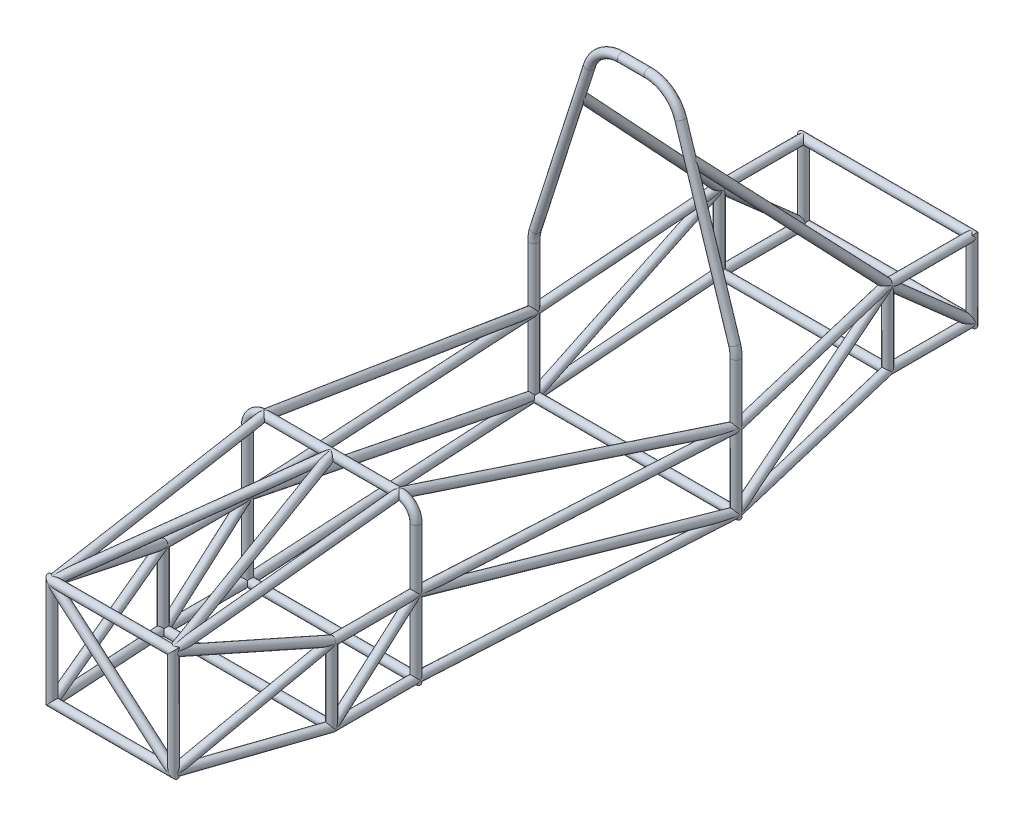
from build123d import *

# Parameters (mm, degrees)
SKETCH11_R                             = 12.7
SKETCH11_R_2                           = 10.3
PIPE_MAIN_HOOP_1_DEPTH                 = 418.960512242
SKETCH11_ON_SEGMENT_2_R                = 12.7
SKETCH11_ON_SEGMENT_2_R_2              = 10.3
PIPE_MAIN_HOOP_1_2_DEPTH               = 637.921024484
SKETCH11_ON_SEGMENT_3_R                = 12.7
SKETCH11_ON_SEGMENT_3_R_2              = 10.3
PIPE_MAIN_HOOP_1_3_DEPTH               = 418.960512242
SKETCH11_ON_SEGMENT_4_R                = 12.7
SKETCH11_ON_SEGMENT_4_R_2              = 10.3
PIPE_MAIN_HOOP_1_4_ANGLE               = 17.744671625
SKETCH11_ON_SEGMENT_5_R                = 12.7
SKETCH11_ON_SEGMENT_5_R_2              = 10.3
PIPE_MAIN_HOOP_1_5_DEPTH               = 524.976189936
SKETCH11_ON_SEGMENT_6_R                = 12.7
SKETCH11_ON_SEGMENT_6_R_2              = 10.3
PIPE_MAIN_HOOP_1_6_ANGLE               = 72.255328375
SKETCH11_ON_SEGMENT_7_R                = 12.7
SKETCH11_ON_SEGMENT_7_R_2              = 10.3
PIPE_MAIN_HOOP_1_7_DEPTH               = 80
SKETCH11_ON_SEGMENT_8_R                = 12.7
SKETCH11_ON_SEGMENT_8_R_2              = 10.3
PIPE_MAIN_HOOP_1_8_ANGLE               = 72.255328375
SKETCH11_ON_SEGMENT_9_R                = 12.7
SKETCH11_ON_SEGMENT_9_R_2              = 10.3
PIPE_MAIN_HOOP_1_9_DEPTH               = 524.976189936
SKETCH11_ON_SEGMENT_10_R               = 12.7
SKETCH11_ON_SEGMENT_10_R_2             = 10.3
PIPE_MAIN_HOOP_1_10_ANGLE              = 17.744671625
PIPE_MAIN_HOOP_2_DEPTH                 = 400
PIPE_MAIN_HOOP_2_DEPTH_BACK            = 18.960512242
SKETCH12_R                             = 12.7
SKETCH12_R_2                           = 10.3
SKETCH12_ON_SEGMENT_2_R                = 12.7
SKETCH12_ON_SEGMENT_2_R_2              = 10.3
PIPE_MAIN_HOOP_2_2_ANGLE               = 90
SKETCH12_ON_SEGMENT_3_R                = 12.7
SKETCH12_ON_SEGMENT_3_R_2              = 10.3
PIPE_MAIN_HOOP_2_3_DEPTH               = 400
SKETCH12_ON_SEGMENT_4_R                = 12.7
SKETCH12_ON_SEGMENT_4_R_2              = 10.3
PIPE_MAIN_HOOP_2_4_ANGLE               = 90
SKETCH12_ON_SEGMENT_5_R                = 12.7
SKETCH12_ON_SEGMENT_5_R_2              = 10.3
PIPE_MAIN_HOOP_2_5_DEPTH               = 418.960512242
SKETCH12_ON_SEGMENT_6_R                = 12.7
SKETCH12_ON_SEGMENT_6_R_2              = 10.3
PIPE_MAIN_HOOP_2_6_DEPTH               = 537.921024484
PIPE_SECONDARY_PROFILE_1_DEPTH         = 328.960512242
PIPE_SECONDARY_PROFILE_1_DEPTH_BACK    = 18.960512242
SKETCH13_R                             = 12.7
SKETCH13_R_2                           = 11.05
SKETCH13_ON_SEGMENT_2_R                = 12.7
SKETCH13_ON_SEGMENT_2_R_2              = 11.05
PIPE_SECONDARY_PROFILE_1_2_DEPTH       = 397.921024484
SKETCH13_ON_SEGMENT_3_R                = 12.7
SKETCH13_ON_SEGMENT_3_R_2              = 11.05
PIPE_SECONDARY_PROFILE_1_3_DEPTH       = 347.921024484
SKETCH13_ON_SEGMENT_4_R                = 12.7
SKETCH13_ON_SEGMENT_4_R_2              = 11.05
PIPE_SECONDARY_PROFILE_1_4_DEPTH       = 397.921024484
SKETCH14_R                             = 12.7
SKETCH14_R_2                           = 11.05
PIPE_SECONDARY_PROFILE_2_DEPTH         = 901.387818866
SKETCH14_ON_SEGMENT_2_R                = 12.7
SKETCH14_ON_SEGMENT_2_R_2              = 11.05
PIPE_SECONDARY_PROFILE_2_2_DEPTH       = 901.387818866
SKETCH15_R                             = 12.7
SKETCH15_R_2                           = 11.05
PIPE_SECONDARY_PROFILE_3_DEPTH         = 927.846970141
SKETCH16_R                             = 12.7
SKETCH16_R_2                           = 11.05
PIPE_SECONDARY_PROFILE_4_DEPTH         = 901.387818866
SKETCH16_ON_SEGMENT_2_R                = 12.7
SKETCH16_ON_SEGMENT_2_R_2              = 11.05
PIPE_SECONDARY_PROFILE_4_2_DEPTH       = 901.387818866
SKETCH17_R                             = 12.7
SKETCH17_R_2                           = 11.05
PIPE_SECONDARY_PROFILE_5_DEPTH         = 927.846970141
SKETCH18_R                             = 12.7
SKETCH18_R_2                           = 11.05
PIPE_SECONDARY_PROFILE_6_DEPTH         = 252.896916642
SKETCH18_ON_SEGMENT_2_R                = 12.7
SKETCH18_ON_SEGMENT_2_R_2              = 11.05
PIPE_SECONDARY_PROFILE_6_2_DEPTH       = 411.921365789
SKETCH19_ON_SEGMENT_1_R                = 12.7
SKETCH19_ON_SEGMENT_1_R_2              = 11.05
PIPE_SECONDARY_PROFILE_7_DEPTH         = 411.921365789
PIPE_SECONDARY_PROFILE_7_2_DEPTH       = 250
PIPE_SECONDARY_PROFILE_7_2_DEPTH_BACK  = 2.896916642
SKETCH19_R                             = 12.7
SKETCH19_R_2                           = 11.05
SKETCH110_R                            = 12.7
SKETCH110_R_2                          = 11.05
PIPE_SECONDARY_PROFILE_8_DEPTH         = 500
SKETCH111_R                            = 12.7
SKETCH111_R_2                          = 11.05
PIPE_SECONDARY_PROFILE_9_DEPTH         = 475.078940809
SKETCH112_R                            = 12.7
SKETCH112_R_2                          = 11.05
PIPE_SECONDARY_PROFILE_10_DEPTH        = 661.245109704
SKETCH112_ON_SEGMENT_2_R               = 12.7
SKETCH112_ON_SEGMENT_2_R_2             = 11.05
PIPE_SECONDARY_PROFILE_10_2_DEPTH      = 938.89254585
SKETCH113_R                            = 12.7
SKETCH113_R_2                          = 11.05
PIPE_SECONDARY_PROFILE_11_DEPTH        = 661.245109704
SKETCH113_ON_SEGMENT_2_R               = 12.7
SKETCH113_ON_SEGMENT_2_R_2             = 11.05
PIPE_SECONDARY_PROFILE_11_2_DEPTH      = 938.89254585
SKETCH114_ON_SEGMENT_1_R               = 12.7
SKETCH114_ON_SEGMENT_1_R_2             = 11.05
PIPE_SECONDARY_PROFILE_12_DEPTH        = 680.574022425
SKETCH114_R                            = 12.7
SKETCH114_R_2                          = 11.05
PIPE_SECONDARY_PROFILE_12_2_DEPTH      = 680.574022425
PIPE_SECONDARY_PROFILE_14_DEPTH        = 518.960512242
PIPE_SECONDARY_PROFILE_14_DEPTH_BACK   = 18.960512242
SKETCH118_R                            = 12.7
SKETCH118_R_2                          = 11.05
SKETCH118_ON_SEGMENT_2_R               = 12.7
SKETCH118_ON_SEGMENT_2_R_2             = 11.05
PIPE_SECONDARY_PROFILE_14_2_DEPTH      = 257.921024484
SKETCH118_ON_SEGMENT_3_R               = 12.7
SKETCH118_ON_SEGMENT_3_R_2             = 11.05
PIPE_SECONDARY_PROFILE_14_3_DEPTH      = 537.921024484
SKETCH118_ON_SEGMENT_4_R               = 12.7
SKETCH118_ON_SEGMENT_4_R_2             = 11.05
PIPE_SECONDARY_PROFILE_14_4_DEPTH      = 257.921024484
SKETCH121_ON_SEGMENT_1_R               = 12.7
SKETCH121_ON_SEGMENT_1_R_2             = 11.05
PIPE_SECONDARY_PROFILE_16_DEPTH        = 433.580673792
PIPE_SECONDARY_PROFILE_16_2_DEPTH      = 250
PIPE_SECONDARY_PROFILE_16_2_DEPTH_BACK = 4.370934853
SKETCH121_R                            = 12.7
SKETCH121_R_2                          = 11.05
SKETCH122_ON_SEGMENT_1_R               = 12.7
SKETCH122_ON_SEGMENT_1_R_2             = 11.05
PIPE_SECONDARY_PROFILE_17_DEPTH        = 433.580673792
PIPE_SECONDARY_PROFILE_17_2_DEPTH      = 250
PIPE_SECONDARY_PROFILE_17_2_DEPTH_BACK = 4.370934853
SKETCH122_R                            = 12.7
SKETCH122_R_2                          = 11.05
SKETCH123_R                            = 12.7
SKETCH123_R_2                          = 11.05
PIPE_SECONDARY_PROFILE_18_DEPTH        = 220
SKETCH124_R                            = 12.7
SKETCH124_R_2                          = 11.05
PIPE_SECONDARY_PROFILE_19_DEPTH        = 220
SKETCH125_R                            = 12.7
SKETCH125_R_2                          = 11.05
PIPE_SECONDARY_PROFILE_20_DEPTH        = 333.016516107
SKETCH126_R                            = 12.7
SKETCH126_R_2                          = 11.05
PIPE_SECONDARY_PROFILE_21_DEPTH        = 333.016516107
SKETCH127_R                            = 12.7
SKETCH127_R_2                          = 11.05
PIPE_SECONDARY_PROFILE_22_DEPTH        = 440.614343843
SKETCH128_R                            = 12.7
SKETCH128_R_2                          = 11.05
PIPE_SECONDARY_PROFILE_23_DEPTH        = 440.614343843
SKETCH129_ON_SEGMENT_1_R               = 12.7
SKETCH129_ON_SEGMENT_1_R_2             = 11.05
PIPE_SECONDARY_PROFILE_24_DEPTH        = 252.86045034
PIPE_SECONDARY_PROFILE_24_2_DEPTH      = 510.84635655
PIPE_SECONDARY_PROFILE_24_2_DEPTH_BACK = 2.86045034
SKETCH129_R                            = 12.7
SKETCH129_R_2                          = 11.05
SKETCH130_R                            = 12.7
SKETCH130_R_2                          = 11.05
PIPE_SECONDARY_PROFILE_25_DEPTH        = 513.70680689
SKETCH130_ON_SEGMENT_2_R               = 12.7
SKETCH130_ON_SEGMENT_2_R_2             = 11.05
PIPE_SECONDARY_PROFILE_25_2_DEPTH      = 252.86045034
SKETCH131_ON_SEGMENT_1_R               = 12.7
SKETCH131_ON_SEGMENT_1_R_2             = 11.05
PIPE_SECONDARY_PROFILE_26_DEPTH        = 252.86045034
PIPE_SECONDARY_PROFILE_26_2_DEPTH      = 510.84635655
PIPE_SECONDARY_PROFILE_26_2_DEPTH_BACK = 2.86045034
SKETCH131_R                            = 12.7
SKETCH131_R_2                          = 11.05
SKETCH132_ON_SEGMENT_1_R               = 12.7
SKETCH132_ON_SEGMENT_1_R_2             = 11.05
PIPE_SECONDARY_PROFILE_27_DEPTH        = 252.86045034
PIPE_SECONDARY_PROFILE_27_2_DEPTH      = 510.84635655
PIPE_SECONDARY_PROFILE_27_2_DEPTH_BACK = 2.86045034
SKETCH132_R                            = 12.7
SKETCH132_R_2                          = 11.05
SKETCH133_ON_SEGMENT_1_R               = 12.7
SKETCH133_ON_SEGMENT_1_R_2             = 11.05
PIPE_SECONDARY_PROFILE_28_DEPTH        = 740.450333948
PIPE_SECONDARY_PROFILE_28_2_DEPTH      = 220
PIPE_SECONDARY_PROFILE_28_2_DEPTH_BACK = 8.230109436
SKETCH133_R                            = 12.7
SKETCH133_R_2                          = 11.05
SKETCH134_R                            = 12.7
SKETCH134_R_2                          = 11.05
PIPE_SECONDARY_PROFILE_29_DEPTH        = 228.230109436
SKETCH134_ON_SEGMENT_2_R               = 12.7
SKETCH134_ON_SEGMENT_2_R_2             = 11.05
PIPE_SECONDARY_PROFILE_29_2_DEPTH      = 740.450333948
SKETCH135_R                            = 12.7
SKETCH135_R_2                          = 11.05
PIPE_SECONDARY_PROFILE_30_DEPTH        = 500
SKETCH137_R                            = 12.7
SKETCH137_R_2                          = 11.05
PIPE_SECONDARY_PROFILE_32_DEPTH        = 591.476119552
SKETCH138_R                            = 12.7
SKETCH138_R_2                          = 11.05
PIPE_SECONDARY_PROFILE_33_DEPTH        = 591.476119552
SKETCH139_R                            = 12.7
SKETCH139_R_2                          = 11.05
PIPE_SECONDARY_PROFILE_34_DEPTH        = 333.016516107
SKETCH140_R                            = 12.7
SKETCH140_R_2                          = 11.05
PIPE_SECONDARY_PROFILE_35_DEPTH        = 333.016516107


with BuildPart() as part:
    # Sketch11 → Pipe MAIN HOOP(1) (new body)
    with BuildSketch(Plane(origin=(600, 400, 0), x_dir=(1, 0, 0), z_dir=(0, -1, 0))):
        Circle(SKETCH11_R)
        Circle(SKETCH11_R_2, mode=Mode.SUBTRACT)
    extrude(amount=PIPE_MAIN_HOOP_1_DEPTH)

    # Pipe MAIN HOOP(1) mitre 1
    split(bisect_by=Plane(origin=(600, 0, 0), x_dir=(-0.707106781, 0.707106781, 0), z_dir=(0.707106781, 0.707106781, 0)), keep=Keep.TOP)


with BuildPart() as body_2:
    # Sketch11 on segment 2 (carried to segment 2) → Pipe MAIN HOOP_1 2 (new body)
    with BuildSketch(Plane(origin=(618.960512242, 0, 0), x_dir=(0, -1, 0), z_dir=(-1, 0, 0))):
        Circle(SKETCH11_ON_SEGMENT_2_R)
        Circle(SKETCH11_ON_SEGMENT_2_R_2, mode=Mode.SUBTRACT)
    extrude(amount=PIPE_MAIN_HOOP_1_2_DEPTH)

    # Pipe MAIN HOOP_1 2 mitre 1
    split(bisect_by=Plane(origin=(600, 0, 0), x_dir=(0.707106781, -0.707106781, 0), z_dir=(-0.707106781, -0.707106781, 0)), keep=Keep.TOP)

    # Pipe MAIN HOOP_1 2 mitre 2
    split(bisect_by=Plane(origin=(0, 0, 0), x_dir=(0.707106781, 0.707106781, 0), z_dir=(0.707106781, -0.707106781, 0)), keep=Keep.TOP)


with BuildPart() as body_3:
    # Sketch11 on segment 3 (carried to segment 3) → Pipe MAIN HOOP_1 3 (new body)
    with BuildSketch(Plane(origin=(0, -18.960512242, 0), x_dir=(-1, 0, 0), z_dir=(0, 1, 0))):
        Circle(SKETCH11_ON_SEGMENT_3_R)
        Circle(SKETCH11_ON_SEGMENT_3_R_2, mode=Mode.SUBTRACT)
    extrude(amount=PIPE_MAIN_HOOP_1_3_DEPTH)

    # Pipe MAIN HOOP_1 3 mitre 1
    split(bisect_by=Plane(origin=(0, 0, 0), x_dir=(-0.707106781, -0.707106781, 0), z_dir=(-0.707106781, 0.707106781, 0)), keep=Keep.TOP)


with BuildPart() as body_4:
    # Sketch11 on segment 4 (carried to the start of arc 4) → Pipe MAIN HOOP_1 4 (revolve)
    with BuildSketch(Plane(origin=(0, 400, 0), x_dir=(-1, 0, 0), z_dir=(0, 1, 0))):
        Circle(SKETCH11_ON_SEGMENT_4_R)
        Circle(SKETCH11_ON_SEGMENT_4_R_2, mode=Mode.SUBTRACT)
    revolve(axis=Axis((100, 400, 0), (0, 0, -1)), revolution_arc=PIPE_MAIN_HOOP_1_4_ANGLE)


with BuildPart() as body_5:
    # Sketch11 on segment 5 (carried to segment 5) → Pipe MAIN HOOP_1 5 (new body)
    with BuildSketch(Plane(origin=(4.75758528, 430.47757271, 0), x_dir=(-0.952424147, 0.304775727, 0), z_dir=(0.304775727, 0.952424147, 0))):
        Circle(SKETCH11_ON_SEGMENT_5_R)
        Circle(SKETCH11_ON_SEGMENT_5_R_2, mode=Mode.SUBTRACT)
    extrude(amount=PIPE_MAIN_HOOP_1_5_DEPTH)


with BuildPart() as body_6:
    # Sketch11 on segment 6 (carried to the start of arc 6) → Pipe MAIN HOOP_1 6 (revolve)
    with BuildSketch(Plane(origin=(164.75758528, 930.47757271, 0), x_dir=(-0.952424147, 0.304775727, 0), z_dir=(0.304775727, 0.952424147, 0))):
        Circle(SKETCH11_ON_SEGMENT_6_R)
        Circle(SKETCH11_ON_SEGMENT_6_R_2, mode=Mode.SUBTRACT)
    revolve(axis=Axis((260, 900, 0), (0, 0, -1)), revolution_arc=PIPE_MAIN_HOOP_1_6_ANGLE)


with BuildPart() as body_7:
    # Sketch11 on segment 7 (carried to segment 7) → Pipe MAIN HOOP_1 7 (new body)
    with BuildSketch(Plane(origin=(260, 1000, 0), x_dir=(0, 1, 0), z_dir=(1, 0, 0))):
        Circle(SKETCH11_ON_SEGMENT_7_R)
        Circle(SKETCH11_ON_SEGMENT_7_R_2, mode=Mode.SUBTRACT)
    extrude(amount=PIPE_MAIN_HOOP_1_7_DEPTH)


with BuildPart() as body_8:
    # Sketch11 on segment 8 (carried to the start of arc 8) → Pipe MAIN HOOP_1 8 (revolve)
    with BuildSketch(Plane(origin=(340, 1000, 0), x_dir=(0, 1, 0), z_dir=(1, 0, 0))):
        Circle(SKETCH11_ON_SEGMENT_8_R)
        Circle(SKETCH11_ON_SEGMENT_8_R_2, mode=Mode.SUBTRACT)
    revolve(axis=Axis((340, 900, 0), (0, 0, -1)), revolution_arc=PIPE_MAIN_HOOP_1_8_ANGLE)


with BuildPart() as body_9:
    # Sketch11 on segment 9 (carried to segment 9) → Pipe MAIN HOOP_1 9 (new body)
    with BuildSketch(Plane(origin=(435.24241472, 930.47757271, 0), x_dir=(0.952424147, 0.304775727, 0), z_dir=(0.304775727, -0.952424147, 0))):
        Circle(SKETCH11_ON_SEGMENT_9_R)
        Circle(SKETCH11_ON_SEGMENT_9_R_2, mode=Mode.SUBTRACT)
    extrude(amount=PIPE_MAIN_HOOP_1_9_DEPTH)


with BuildPart() as body_10:
    # Sketch11 on segment 10 (carried to the start of arc 10) → Pipe MAIN HOOP_1 10 (revolve)
    with BuildSketch(Plane(origin=(595.24241472, 430.47757271, 0), x_dir=(0.952424147, 0.304775727, 0), z_dir=(0.304775727, -0.952424147, 0))):
        Circle(SKETCH11_ON_SEGMENT_10_R)
        Circle(SKETCH11_ON_SEGMENT_10_R_2, mode=Mode.SUBTRACT)
    revolve(axis=Axis((500, 400, 0), (0, 0, -1)), revolution_arc=PIPE_MAIN_HOOP_1_10_ANGLE)


with BuildPart() as body_11:
    # Sketch12 → Pipe MAIN HOOP(2) (new, two sides: drawn at the far end of the back side and taken through both)
    with BuildSketch(Plane(origin=(550, 0, 900), x_dir=(-1, 0, 0), z_dir=(0, 1, 0)).offset(-PIPE_MAIN_HOOP_2_DEPTH_BACK)):
        Circle(SKETCH12_R)
        Circle(SKETCH12_R_2, mode=Mode.SUBTRACT)
    extrude(amount=PIPE_MAIN_HOOP_2_DEPTH + PIPE_MAIN_HOOP_2_DEPTH_BACK)

    # Pipe MAIN HOOP(2) mitre 1
    split(bisect_by=Plane(origin=(550, 0, 900), x_dir=(-0.707106781, 0.707106781, 0), z_dir=(0.707106781, 0.707106781, 0)), keep=Keep.TOP)


with BuildPart() as body_12:
    # Sketch12 on segment 2 (carried to the start of arc 2) → Pipe MAIN HOOP_2 2 (revolve)
    with BuildSketch(Plane(origin=(550, 400, 900), x_dir=(-1, 0, 0), z_dir=(0, 1, 0))):
        Circle(SKETCH12_ON_SEGMENT_2_R)
        Circle(SKETCH12_ON_SEGMENT_2_R_2, mode=Mode.SUBTRACT)
    revolve(axis=Axis((500, 400, 900), (0, 0, 1)), revolution_arc=PIPE_MAIN_HOOP_2_2_ANGLE)


with BuildPart() as body_13:
    # Sketch12 on segment 3 (carried to segment 3) → Pipe MAIN HOOP_2 3 (new body)
    with BuildSketch(Plane(origin=(500, 450, 900), x_dir=(0, -1, 0), z_dir=(-1, 0, 0))):
        Circle(SKETCH12_ON_SEGMENT_3_R)
        Circle(SKETCH12_ON_SEGMENT_3_R_2, mode=Mode.SUBTRACT)
    extrude(amount=PIPE_MAIN_HOOP_2_3_DEPTH)


with BuildPart() as body_14:
    # Sketch12 on segment 4 (carried to the start of arc 4) → Pipe MAIN HOOP_2 4 (revolve)
    with BuildSketch(Plane(origin=(100, 450, 900), x_dir=(0, -1, 0), z_dir=(-1, 0, 0))):
        Circle(SKETCH12_ON_SEGMENT_4_R)
        Circle(SKETCH12_ON_SEGMENT_4_R_2, mode=Mode.SUBTRACT)
    revolve(axis=Axis((100, 400, 900), (0, 0, 1)), revolution_arc=PIPE_MAIN_HOOP_2_4_ANGLE)


with BuildPart() as body_15:
    # Sketch12 on segment 5 (carried to segment 5) → Pipe MAIN HOOP_2 5 (new body)
    with BuildSketch(Plane(origin=(50, 400, 900), x_dir=(1, 0, 0), z_dir=(0, -1, 0))):
        Circle(SKETCH12_ON_SEGMENT_5_R)
        Circle(SKETCH12_ON_SEGMENT_5_R_2, mode=Mode.SUBTRACT)
    extrude(amount=PIPE_MAIN_HOOP_2_5_DEPTH)

    # Pipe MAIN HOOP_2 5 mitre 1
    split(bisect_by=Plane(origin=(50, 0, 900), x_dir=(-0.707106781, -0.707106781, 0), z_dir=(-0.707106781, 0.707106781, 0)), keep=Keep.TOP)


with BuildPart() as body_16:
    # Sketch12 on segment 6 (carried to segment 6) → Pipe MAIN HOOP_2 6 (new body)
    with BuildSketch(Plane(origin=(31.039487758, 0, 900), x_dir=(0, 1, 0), z_dir=(1, 0, 0))):
        Circle(SKETCH12_ON_SEGMENT_6_R)
        Circle(SKETCH12_ON_SEGMENT_6_R_2, mode=Mode.SUBTRACT)
    extrude(amount=PIPE_MAIN_HOOP_2_6_DEPTH)

    # Pipe MAIN HOOP_2 6 mitre 1
    split(bisect_by=Plane(origin=(50, 0, 900), x_dir=(0.707106781, 0.707106781, 0), z_dir=(0.707106781, -0.707106781, 0)), keep=Keep.TOP)

    # Pipe MAIN HOOP_2 6 mitre 2
    split(bisect_by=Plane(origin=(550, 0, 900), x_dir=(0.707106781, -0.707106781, 0), z_dir=(-0.707106781, -0.707106781, 0)), keep=Keep.TOP)


with BuildPart() as body_17:
    # Sketch13 → Pipe SECONDARY PROFILE(1) (new, two sides: drawn at the far end of the back side and taken through both)
    with BuildSketch(Plane(origin=(120, 359, 1550), x_dir=(1, 0, 0), z_dir=(0, -1, 0)).offset(-PIPE_SECONDARY_PROFILE_1_DEPTH_BACK)):
        Circle(SKETCH13_R)
        Circle(SKETCH13_R_2, mode=Mode.SUBTRACT)
    extrude(amount=PIPE_SECONDARY_PROFILE_1_DEPTH + PIPE_SECONDARY_PROFILE_1_DEPTH_BACK)

    # Pipe SECONDARY PROFILE(1) mitre 1
    split(bisect_by=Plane(origin=(120, 359, 1550), x_dir=(0.707106781, -0.707106781, 0), z_dir=(-0.707106781, -0.707106781, 0)), keep=Keep.TOP)

    # Pipe SECONDARY PROFILE(1) mitre 2
    split(bisect_by=Plane(origin=(120, 49, 1550), x_dir=(-0.707106781, -0.707106781, 0), z_dir=(-0.707106781, 0.707106781, 0)), keep=Keep.TOP)


with BuildPart() as body_18:
    # Sketch13 on segment 2 (carried to segment 2) → Pipe SECONDARY PROFILE_1 2 (new body)
    with BuildSketch(Plane(origin=(101.039487758, 49, 1550), x_dir=(0, 1, 0), z_dir=(1, 0, 0))):
        Circle(SKETCH13_ON_SEGMENT_2_R)
        Circle(SKETCH13_ON_SEGMENT_2_R_2, mode=Mode.SUBTRACT)
    extrude(amount=PIPE_SECONDARY_PROFILE_1_2_DEPTH)

    # Pipe SECONDARY PROFILE_1 2 mitre 1
    split(bisect_by=Plane(origin=(120, 49, 1550), x_dir=(0.707106781, 0.707106781, 0), z_dir=(0.707106781, -0.707106781, 0)), keep=Keep.TOP)

    # Pipe SECONDARY PROFILE_1 2 mitre 2
    split(bisect_by=Plane(origin=(480, 49, 1550), x_dir=(0.707106781, -0.707106781, 0), z_dir=(-0.707106781, -0.707106781, 0)), keep=Keep.TOP)


with BuildPart() as body_19:
    # Sketch13 on segment 3 (carried to segment 3) → Pipe SECONDARY PROFILE_1 3 (new body)
    with BuildSketch(Plane(origin=(480, 30.039487758, 1550), x_dir=(-1, 0, 0), z_dir=(0, 1, 0))):
        Circle(SKETCH13_ON_SEGMENT_3_R)
        Circle(SKETCH13_ON_SEGMENT_3_R_2, mode=Mode.SUBTRACT)
    extrude(amount=PIPE_SECONDARY_PROFILE_1_3_DEPTH)

    # Pipe SECONDARY PROFILE_1 3 mitre 1
    split(bisect_by=Plane(origin=(480, 49, 1550), x_dir=(-0.707106781, 0.707106781, 0), z_dir=(0.707106781, 0.707106781, 0)), keep=Keep.TOP)

    # Pipe SECONDARY PROFILE_1 3 mitre 2
    split(bisect_by=Plane(origin=(480, 359, 1550), x_dir=(0.707106781, 0.707106781, 0), z_dir=(0.707106781, -0.707106781, 0)), keep=Keep.TOP)


with BuildPart() as body_20:
    # Sketch13 on segment 4 (carried to segment 4) → Pipe SECONDARY PROFILE_1 4 (new body)
    with BuildSketch(Plane(origin=(498.960512242, 359, 1550), x_dir=(0, -1, 0), z_dir=(-1, 0, 0))):
        Circle(SKETCH13_ON_SEGMENT_4_R)
        Circle(SKETCH13_ON_SEGMENT_4_R_2, mode=Mode.SUBTRACT)
    extrude(amount=PIPE_SECONDARY_PROFILE_1_4_DEPTH)

    # Pipe SECONDARY PROFILE_1 4 mitre 1
    split(bisect_by=Plane(origin=(480, 359, 1550), x_dir=(-0.707106781, -0.707106781, 0), z_dir=(-0.707106781, 0.707106781, 0)), keep=Keep.TOP)

    # Pipe SECONDARY PROFILE_1 4 mitre 2
    split(bisect_by=Plane(origin=(120, 359, 1550), x_dir=(-0.707106781, 0.707106781, 0), z_dir=(0.707106781, 0.707106781, 0)), keep=Keep.TOP)


with BuildPart() as body_21:
    # Sketch14 → Pipe SECONDARY PROFILE(2) (new body)
    with BuildSketch(Plane(origin=(600, 0, 0), x_dir=(0.9984603532054125, 0, 0.05547001962252284), z_dir=(-0.05547001962252284, 0, 0.9984603532054125))):
        Circle(SKETCH14_R)
        Circle(SKETCH14_R_2, mode=Mode.SUBTRACT)
    extrude(amount=PIPE_SECONDARY_PROFILE_2_DEPTH)


with BuildPart() as body_22:
    # Sketch14 on segment 2 (carried to segment 2) → Pipe SECONDARY PROFILE_2 2 (new body)
    with BuildSketch(Plane(origin=(600, 220, 0), x_dir=(0.998460353, 0, 0.05547002), z_dir=(-0.05547002, 0, 0.998460353))):
        Circle(SKETCH14_ON_SEGMENT_2_R)
        Circle(SKETCH14_ON_SEGMENT_2_R_2, mode=Mode.SUBTRACT)
    extrude(amount=PIPE_SECONDARY_PROFILE_2_2_DEPTH)


with BuildPart() as body_23:
    # Sketch15 → Pipe SECONDARY PROFILE(3) (new body)
    with BuildSketch(Plane(origin=(550, 220, 900), x_dir=(0.9032422622823458, 0.4257340459576791, -0.05388819666285796), z_dir=(0.05388819666285806, -0.23710806531657555, -0.9699875399314446))):
        Circle(SKETCH15_R)
        Circle(SKETCH15_R_2, mode=Mode.SUBTRACT)
    extrude(amount=PIPE_SECONDARY_PROFILE_3_DEPTH)


with BuildPart() as body_24:
    # Sketch16 → Pipe SECONDARY PROFILE(4) (new body)
    with BuildSketch(Plane(origin=(0, 0, 0), x_dir=(0.9984603532054125, 0, -0.05547001962252292), z_dir=(0.05547001962252292, 0, 0.9984603532054125))):
        Circle(SKETCH16_R)
        Circle(SKETCH16_R_2, mode=Mode.SUBTRACT)
    extrude(amount=PIPE_SECONDARY_PROFILE_4_DEPTH)


with BuildPart() as body_25:
    # Sketch16 on segment 2 (carried to segment 2) → Pipe SECONDARY PROFILE_4 2 (new body)
    with BuildSketch(Plane(origin=(0, 220, 0), x_dir=(0.998460353, 0, -0.05547002), z_dir=(0.05547002, 0, 0.998460353))):
        Circle(SKETCH16_ON_SEGMENT_2_R)
        Circle(SKETCH16_ON_SEGMENT_2_R_2, mode=Mode.SUBTRACT)
    extrude(amount=PIPE_SECONDARY_PROFILE_4_2_DEPTH)


with BuildPart() as body_26:
    # Sketch17 → Pipe SECONDARY PROFILE(5) (new body)
    with BuildSketch(Plane(origin=(50, 220, 900), x_dir=(0.9032422622823457, -0.4257340459576792, 0.053888196662858), z_dir=(-0.053888196662858066, -0.23710806531657555, -0.9699875399314445))):
        Circle(SKETCH17_R)
        Circle(SKETCH17_R_2, mode=Mode.SUBTRACT)
    extrude(amount=PIPE_SECONDARY_PROFILE_5_DEPTH)


with BuildPart() as body_27:
    # Sketch18 → Pipe SECONDARY PROFILE(6) (new body)
    with BuildSketch(Plane(origin=(50, 0, 900), x_dir=(1, 0, 0), z_dir=(0, 0, 1))):
        Circle(SKETCH18_R)
        Circle(SKETCH18_R_2, mode=Mode.SUBTRACT)
    extrude(amount=PIPE_SECONDARY_PROFILE_6_DEPTH)

    # Pipe SECONDARY PROFILE(6) mitre 1
    split(bisect_by=Plane(origin=(50, 0, 1150), x_dir=(0, 0.998170864, -0.060455988), z_dir=(-0.086045386, -0.06023177, -0.994468866)), keep=Keep.TOP)


with BuildPart() as body_28:
    # Sketch18 on segment 2 (carried to segment 2) → Pipe SECONDARY PROFILE_6 2 (new body)
    with BuildSketch(Plane(origin=(49.504224832, -0.347042617, 1147.166999041), x_dir=(0.985192383, -0.010365332, -0.171138914), z_dir=(0.171138914, 0.11979724, 0.977936651))):
        Circle(SKETCH18_ON_SEGMENT_2_R)
        Circle(SKETCH18_ON_SEGMENT_2_R_2, mode=Mode.SUBTRACT)
    extrude(amount=PIPE_SECONDARY_PROFILE_6_2_DEPTH)

    # Pipe SECONDARY PROFILE_6 2 mitre 1
    split(bisect_by=Plane(origin=(50, 0, 1150), x_dir=(0, -0.998170864, 0.060455988), z_dir=(0.086045386, 0.06023177, 0.994468866)), keep=Keep.TOP)


with BuildPart() as body_29:
    # Sketch19 on segment 1 (carried to segment 1) → Pipe SECONDARY PROFILE(7) (new body)
    with BuildSketch(Plane(origin=(480, 49, 1550), x_dir=(0.985192383, 0.010365332, 0.171138914), z_dir=(0.171138914, -0.11979724, -0.977936651))):
        Circle(SKETCH19_ON_SEGMENT_1_R)
        Circle(SKETCH19_ON_SEGMENT_1_R_2, mode=Mode.SUBTRACT)
    extrude(amount=PIPE_SECONDARY_PROFILE_7_DEPTH)

    # Pipe SECONDARY PROFILE(7) mitre 1
    split(bisect_by=Plane(origin=(550, 0, 1150), x_dir=(0, -0.998170864, 0.060455988), z_dir=(-0.086045386, 0.06023177, 0.994468866)), keep=Keep.TOP)


with BuildPart() as body_30:
    # Sketch19 → Pipe SECONDARY PROFILE_7 2 (new, two sides: drawn at the far end of the back side and taken through both)
    with BuildSketch(Plane(origin=(550, 0, 1150), x_dir=(1, 0, 0), z_dir=(0, 0, -1)).offset(-PIPE_SECONDARY_PROFILE_7_2_DEPTH_BACK)):
        Circle(SKETCH19_R)
        Circle(SKETCH19_R_2, mode=Mode.SUBTRACT)
    extrude(amount=PIPE_SECONDARY_PROFILE_7_2_DEPTH + PIPE_SECONDARY_PROFILE_7_2_DEPTH_BACK)

    # Pipe SECONDARY PROFILE_7 2 mitre 1
    split(bisect_by=Plane(origin=(550, 0, 1150), x_dir=(0, 0.998170864, -0.060455988), z_dir=(0.086045386, -0.06023177, -0.994468866)), keep=Keep.TOP)


with BuildPart() as body_31:
    # Sketch110 → Pipe SECONDARY PROFILE(8) (new body)
    with BuildSketch(Plane(origin=(50, 0, 1150), x_dir=(0, 0, -1), z_dir=(1, 0, 0))):
        Circle(SKETCH110_R)
        Circle(SKETCH110_R_2, mode=Mode.SUBTRACT)
    extrude(amount=PIPE_SECONDARY_PROFILE_8_DEPTH)


with BuildPart() as body_32:
    # Sketch111 → Pipe SECONDARY PROFILE(9) (new body)
    with BuildSketch(Plane(origin=(120, 359, 1550), x_dir=(0.42578644217988465, 0.4944616747895436, -0.757768802353406), z_dir=(0.7577688023534062, -0.6525231353598773, 0))):
        Circle(SKETCH111_R)
        Circle(SKETCH111_R_2, mode=Mode.SUBTRACT)
    extrude(amount=PIPE_SECONDARY_PROFILE_9_DEPTH)


with BuildPart() as body_33:
    # Sketch112 → Pipe SECONDARY PROFILE(10) (new body)
    with BuildSketch(Plane(origin=(120, 359, 1550), x_dir=(0.9083109191261359, 0.41718531797608155, 0.030457916235847243), z_dir=(-0.030457916235847222, 0.1385835188731049, -0.9898822776650352))):
        Circle(SKETCH112_R)
        Circle(SKETCH112_R_2, mode=Mode.SUBTRACT)
    extrude(amount=PIPE_SECONDARY_PROFILE_10_DEPTH)

    # Pipe SECONDARY PROFILE(10) mitre 1
    split(bisect_by=Plane(origin=(100, 450, 900), x_dir=(0, -0.998486223, 0.055002393), z_dir=(0.070113859, 0.054867032, 0.996028943)), keep=Keep.TOP)


with BuildPart() as body_34:
    # Sketch112 on segment 2 (carried to segment 2) → Pipe SECONDARY PROFILE_10 2 (new body)
    with BuildSketch(Plane(origin=(100.49249857, 451.132746712, 904.432487133), x_dir=(0.891916634, 0.404356103, -0.202437297), z_dir=(-0.107033014, -0.246175931, -0.963297122))):
        Circle(SKETCH112_ON_SEGMENT_2_R)
        Circle(SKETCH112_ON_SEGMENT_2_R_2, mode=Mode.SUBTRACT)
    extrude(amount=PIPE_SECONDARY_PROFILE_10_2_DEPTH)

    # Pipe SECONDARY PROFILE_10 2 mitre 1
    split(bisect_by=Plane(origin=(100, 450, 900), x_dir=(0, 0.998486223, -0.055002393), z_dir=(-0.070113859, -0.054867032, -0.996028943)), keep=Keep.TOP)


with BuildPart() as body_35:
    # Sketch113 → Pipe SECONDARY PROFILE(11) (new body)
    with BuildSketch(Plane(origin=(480, 359, 1550), x_dir=(0.908310919126136, -0.4171853179760814, -0.030457916235847274), z_dir=(0.03045791623584735, 0.13858351887310533, -0.9898822776650352))):
        Circle(SKETCH113_R)
        Circle(SKETCH113_R_2, mode=Mode.SUBTRACT)
    extrude(amount=PIPE_SECONDARY_PROFILE_11_DEPTH)

    # Pipe SECONDARY PROFILE(11) mitre 1
    split(bisect_by=Plane(origin=(500, 450, 900), x_dir=(0, -0.998486223, 0.055002393), z_dir=(-0.070113859, 0.054867032, 0.996028943)), keep=Keep.TOP)


with BuildPart() as body_36:
    # Sketch113 on segment 2 (carried to segment 2) → Pipe SECONDARY PROFILE_11 2 (new body)
    with BuildSketch(Plane(origin=(499.50750143, 451.132746712, 904.432487133), x_dir=(0.891916634, -0.404356103, 0.202437297), z_dir=(0.107033014, -0.246175931, -0.963297122))):
        Circle(SKETCH113_ON_SEGMENT_2_R)
        Circle(SKETCH113_ON_SEGMENT_2_R_2, mode=Mode.SUBTRACT)
    extrude(amount=PIPE_SECONDARY_PROFILE_11_2_DEPTH)

    # Pipe SECONDARY PROFILE_11 2 mitre 1
    split(bisect_by=Plane(origin=(500, 450, 900), x_dir=(0, 0.998486223, -0.055002393), z_dir=(0.070113859, -0.054867032, -0.996028943)), keep=Keep.TOP)


with BuildPart() as body_37:
    # Sketch114 on segment 1 (carried to segment 1) → Pipe SECONDARY PROFILE(12) (new body)
    with BuildSketch(Plane(origin=(480, 359, 1550), x_dir=(-0.964220802, -0.018088372, 0.264482619), z_dir=(-0.264482619, 0.133710657, -0.955076125))):
        Circle(SKETCH114_ON_SEGMENT_1_R)
        Circle(SKETCH114_ON_SEGMENT_1_R_2, mode=Mode.SUBTRACT)
    extrude(amount=PIPE_SECONDARY_PROFILE_12_DEPTH)


with BuildPart() as body_38:
    # Sketch114 → Pipe SECONDARY PROFILE_12 2 (new body)
    with BuildSketch(Plane(origin=(300, 450, 900), x_dir=(0.9642208019615072, -0.018088372341682465, 0.2644826191845819), z_dir=(-0.2644826191845819, -0.1337106574766498, 0.9550761248332121))):
        Circle(SKETCH114_R)
        Circle(SKETCH114_R_2, mode=Mode.SUBTRACT)
    extrude(amount=PIPE_SECONDARY_PROFILE_12_2_DEPTH)


with BuildPart() as body_39:
    # Sketch118 → Pipe SECONDARY PROFILE(14) (new, two sides: drawn at the far end of the back side and taken through both)
    with BuildSketch(Plane(origin=(550, 92, -750), x_dir=(0, 0, 1), z_dir=(-1, 0, 0)).offset(-PIPE_SECONDARY_PROFILE_14_DEPTH_BACK)):
        Circle(SKETCH118_R)
        Circle(SKETCH118_R_2, mode=Mode.SUBTRACT)
    extrude(amount=PIPE_SECONDARY_PROFILE_14_DEPTH + PIPE_SECONDARY_PROFILE_14_DEPTH_BACK)

    # Pipe SECONDARY PROFILE(14) mitre 1
    split(bisect_by=Plane(origin=(550, 92, -750), x_dir=(0.707106781, -0.707106781, 0), z_dir=(-0.707106781, -0.707106781, 0)), keep=Keep.TOP)

    # Pipe SECONDARY PROFILE(14) mitre 2
    split(bisect_by=Plane(origin=(50, 92, -750), x_dir=(0.707106781, 0.707106781, 0), z_dir=(0.707106781, -0.707106781, 0)), keep=Keep.TOP)


with BuildPart() as body_40:
    # Sketch118 on segment 2 (carried to segment 2) → Pipe SECONDARY PROFILE_14 2 (new body)
    with BuildSketch(Plane(origin=(50, 73.039487758, -750), x_dir=(0, 0, 1), z_dir=(0, 1, 0))):
        Circle(SKETCH118_ON_SEGMENT_2_R)
        Circle(SKETCH118_ON_SEGMENT_2_R_2, mode=Mode.SUBTRACT)
    extrude(amount=PIPE_SECONDARY_PROFILE_14_2_DEPTH)

    # Pipe SECONDARY PROFILE_14 2 mitre 1
    split(bisect_by=Plane(origin=(50, 92, -750), x_dir=(-0.707106781, -0.707106781, 0), z_dir=(-0.707106781, 0.707106781, 0)), keep=Keep.TOP)

    # Pipe SECONDARY PROFILE_14 2 mitre 2
    split(bisect_by=Plane(origin=(50, 312, -750), x_dir=(0.707106781, -0.707106781, 0), z_dir=(-0.707106781, -0.707106781, 0)), keep=Keep.TOP)


with BuildPart() as body_41:
    # Sketch118 on segment 3 (carried to segment 3) → Pipe SECONDARY PROFILE_14 3 (new body)
    with BuildSketch(Plane(origin=(31.039487758, 312, -750), x_dir=(0, 0, 1), z_dir=(1, 0, 0))):
        Circle(SKETCH118_ON_SEGMENT_3_R)
        Circle(SKETCH118_ON_SEGMENT_3_R_2, mode=Mode.SUBTRACT)
    extrude(amount=PIPE_SECONDARY_PROFILE_14_3_DEPTH)

    # Pipe SECONDARY PROFILE_14 3 mitre 1
    split(bisect_by=Plane(origin=(50, 312, -750), x_dir=(-0.707106781, 0.707106781, 0), z_dir=(0.707106781, 0.707106781, 0)), keep=Keep.TOP)

    # Pipe SECONDARY PROFILE_14 3 mitre 2
    split(bisect_by=Plane(origin=(550, 312, -750), x_dir=(-0.707106781, -0.707106781, 0), z_dir=(-0.707106781, 0.707106781, 0)), keep=Keep.TOP)


with BuildPart() as body_42:
    # Sketch118 on segment 4 (carried to segment 4) → Pipe SECONDARY PROFILE_14 4 (new body)
    with BuildSketch(Plane(origin=(550, 330.960512242, -750), x_dir=(0, 0, 1), z_dir=(0, -1, 0))):
        Circle(SKETCH118_ON_SEGMENT_4_R)
        Circle(SKETCH118_ON_SEGMENT_4_R_2, mode=Mode.SUBTRACT)
    extrude(amount=PIPE_SECONDARY_PROFILE_14_4_DEPTH)

    # Pipe SECONDARY PROFILE_14 4 mitre 1
    split(bisect_by=Plane(origin=(550, 312, -750), x_dir=(0.707106781, 0.707106781, 0), z_dir=(0.707106781, -0.707106781, 0)), keep=Keep.TOP)

    # Pipe SECONDARY PROFILE_14 4 mitre 2
    split(bisect_by=Plane(origin=(550, 92, -750), x_dir=(-0.707106781, 0.707106781, 0), z_dir=(0.707106781, 0.707106781, 0)), keep=Keep.TOP)


with BuildPart() as body_43:
    # Sketch121 on segment 1 (carried to segment 1) → Pipe SECONDARY PROFILE(16) (new body)
    with BuildSketch(Plane(origin=(480, 359, 1550), x_dir=(0.986232277, 0.027338764, 0.163090428), z_dir=(0.163090428, -0.323850993, -0.931945303))):
        Circle(SKETCH121_ON_SEGMENT_1_R)
        Circle(SKETCH121_ON_SEGMENT_1_R_2, mode=Mode.SUBTRACT)
    extrude(amount=PIPE_SECONDARY_PROFILE_16_DEPTH)

    # Pipe SECONDARY PROFILE(16) mitre 1
    split(bisect_by=Plane(origin=(550, 220, 1150), x_dir=(0, -0.986239507, 0.165322819), z_dir=(-0.082969039, 0.164752807, 0.982839077)), keep=Keep.TOP)


with BuildPart() as body_44:
    # Sketch121 → Pipe SECONDARY PROFILE_16 2 (new, two sides: drawn at the far end of the back side and taken through both)
    with BuildSketch(Plane(origin=(550, 220, 1150), x_dir=(1, 0, 0), z_dir=(0, 0, -1)).offset(-PIPE_SECONDARY_PROFILE_16_2_DEPTH_BACK)):
        Circle(SKETCH121_R)
        Circle(SKETCH121_R_2, mode=Mode.SUBTRACT)
    extrude(amount=PIPE_SECONDARY_PROFILE_16_2_DEPTH + PIPE_SECONDARY_PROFILE_16_2_DEPTH_BACK)

    # Pipe SECONDARY PROFILE_16 2 mitre 1
    split(bisect_by=Plane(origin=(550, 220, 1150), x_dir=(0, 0.986239507, -0.165322819), z_dir=(0.082969039, -0.164752807, -0.982839077)), keep=Keep.TOP)


with BuildPart() as body_45:
    # Sketch122 on segment 1 (carried to segment 1) → Pipe SECONDARY PROFILE(17) (new body)
    with BuildSketch(Plane(origin=(120, 359, 1550), x_dir=(0.986232277, -0.027338764, -0.163090428), z_dir=(-0.163090428, -0.323850993, -0.931945303))):
        Circle(SKETCH122_ON_SEGMENT_1_R)
        Circle(SKETCH122_ON_SEGMENT_1_R_2, mode=Mode.SUBTRACT)
    extrude(amount=PIPE_SECONDARY_PROFILE_17_DEPTH)

    # Pipe SECONDARY PROFILE(17) mitre 1
    split(bisect_by=Plane(origin=(50, 220, 1150), x_dir=(0, -0.986239507, 0.165322819), z_dir=(0.082969039, 0.164752807, 0.982839077)), keep=Keep.TOP)


with BuildPart() as body_46:
    # Sketch122 → Pipe SECONDARY PROFILE_17 2 (new, two sides: drawn at the far end of the back side and taken through both)
    with BuildSketch(Plane(origin=(50, 220, 1150), x_dir=(1, 0, 0), z_dir=(0, 0, -1)).offset(-PIPE_SECONDARY_PROFILE_17_2_DEPTH_BACK)):
        Circle(SKETCH122_R)
        Circle(SKETCH122_R_2, mode=Mode.SUBTRACT)
    extrude(amount=PIPE_SECONDARY_PROFILE_17_2_DEPTH + PIPE_SECONDARY_PROFILE_17_2_DEPTH_BACK)

    # Pipe SECONDARY PROFILE_17 2 mitre 1
    split(bisect_by=Plane(origin=(50, 220, 1150), x_dir=(0, 0.986239507, -0.165322819), z_dir=(-0.082969039, -0.164752807, -0.982839077)), keep=Keep.TOP)


with BuildPart() as body_47:
    # Sketch123 → Pipe SECONDARY PROFILE(18) (new body)
    with BuildSketch(Plane(origin=(50, 0, 1150), x_dir=(1, 0, 0), z_dir=(0, 1, 0))):
        Circle(SKETCH123_R)
        Circle(SKETCH123_R_2, mode=Mode.SUBTRACT)
    extrude(amount=PIPE_SECONDARY_PROFILE_18_DEPTH)


with BuildPart() as body_48:
    # Sketch124 → Pipe SECONDARY PROFILE(19) (new body)
    with BuildSketch(Plane(origin=(550, 0, 1150), x_dir=(1, 0, 0), z_dir=(0, 1, 0))):
        Circle(SKETCH124_R)
        Circle(SKETCH124_R_2, mode=Mode.SUBTRACT)
    extrude(amount=PIPE_SECONDARY_PROFILE_19_DEPTH)


with BuildPart() as body_49:
    # Sketch125 → Pipe SECONDARY PROFILE(20) (new body)
    with BuildSketch(Plane(origin=(50, 0, 1150), x_dir=(1, 0, 0), z_dir=(0, 0.6606278948920249, -0.7507135169227552))):
        Circle(SKETCH125_R)
        Circle(SKETCH125_R_2, mode=Mode.SUBTRACT)
    extrude(amount=PIPE_SECONDARY_PROFILE_20_DEPTH)


with BuildPart() as body_50:
    # Sketch126 → Pipe SECONDARY PROFILE(21) (new body)
    with BuildSketch(Plane(origin=(550, 220, 900), x_dir=(1, 0, 0), z_dir=(0, -0.6606278948920249, 0.7507135169227552))):
        Circle(SKETCH126_R)
        Circle(SKETCH126_R_2, mode=Mode.SUBTRACT)
    extrude(amount=PIPE_SECONDARY_PROFILE_21_DEPTH)


with BuildPart() as body_51:
    # Sketch127 → Pipe SECONDARY PROFILE(22) (new body)
    with BuildSketch(Plane(origin=(120, 49, 1550), x_dir=(0.726184513350313, 0.6688921173870929, 0.15886909034667737), z_dir=(-0.1588690903466775, 0.38809449213259783, -0.9078233734095859))):
        Circle(SKETCH127_R)
        Circle(SKETCH127_R_2, mode=Mode.SUBTRACT)
    extrude(amount=PIPE_SECONDARY_PROFILE_22_DEPTH)


with BuildPart() as body_52:
    # Sketch128 → Pipe SECONDARY PROFILE(23) (new body)
    with BuildSketch(Plane(origin=(550, 220, 1150), x_dir=(0.9867705846257278, -0.03231757184286515, 0.15886909034667757), z_dir=(-0.1588690903466776, -0.3880944921325977, 0.9078233734095859))):
        Circle(SKETCH128_R)
        Circle(SKETCH128_R_2, mode=Mode.SUBTRACT)
    extrude(amount=PIPE_SECONDARY_PROFILE_23_DEPTH)


with BuildPart() as body_53:
    # Sketch129 on segment 1 (carried to segment 1) → Pipe SECONDARY PROFILE(24) (new body)
    with BuildSketch(Plane(origin=(550, 92, -750), x_dir=(1, 0, 0), z_dir=(0, 0, 1))):
        Circle(SKETCH129_ON_SEGMENT_1_R)
        Circle(SKETCH129_ON_SEGMENT_1_R_2, mode=Mode.SUBTRACT)
    extrude(amount=PIPE_SECONDARY_PROFILE_24_DEPTH)

    # Pipe SECONDARY PROFILE(24) mitre 1
    split(bisect_by=Plane(origin=(550, 92, -500), x_dir=(0, 0.995883885, 0.090638223), z_dir=(-0.049200247, 0.090528454, -0.994677804)), keep=Keep.TOP)


with BuildPart() as body_54:
    # Sketch129 → Pipe SECONDARY PROFILE_24 2 (new, two sides: drawn at the far end of the back side and taken through both)
    with BuildSketch(Plane(origin=(550, 92, -500), x_dir=(0.9951586714287673, 0.008908044571068092, -0.09787678694180005), z_dir=(0.09787678694180008, -0.1800932879729124, 0.9787678694180022)).offset(-PIPE_SECONDARY_PROFILE_24_2_DEPTH_BACK)):
        Circle(SKETCH129_R)
        Circle(SKETCH129_R_2, mode=Mode.SUBTRACT)
    extrude(amount=PIPE_SECONDARY_PROFILE_24_2_DEPTH + PIPE_SECONDARY_PROFILE_24_2_DEPTH_BACK)

    # Pipe SECONDARY PROFILE_24 2 mitre 1
    split(bisect_by=Plane(origin=(550, 92, -500), x_dir=(0, -0.995883885, -0.090638223), z_dir=(0.049200247, -0.090528454, 0.994677804)), keep=Keep.TOP)


with BuildPart() as body_55:
    # Sketch130 → Pipe SECONDARY PROFILE(25) (new body)
    with BuildSketch(Plane(origin=(0, 0, 0), x_dir=(0.5488033862144286, -0.8302017693654515, -0.09787678694180021), z_dir=(0.09787678694180035, 0.18009328797291246, -0.9787678694180021))):
        Circle(SKETCH130_R)
        Circle(SKETCH130_R_2, mode=Mode.SUBTRACT)
    extrude(amount=PIPE_SECONDARY_PROFILE_25_DEPTH)

    # Pipe SECONDARY PROFILE(25) mitre 1
    split(bisect_by=Plane(origin=(50, 92, -500), x_dir=(0, -0.995883885, -0.090638223), z_dir=(-0.049200247, -0.090528454, 0.994677804)), keep=Keep.TOP)


with BuildPart() as body_56:
    # Sketch130 on segment 2 (carried to segment 2) → Pipe SECONDARY PROFILE_25 2 (new body)
    with BuildSketch(Plane(origin=(50, 92, -497.13954966), x_dir=(0.543962058, -0.839109814, 0), z_dir=(0, 0, -1))):
        Circle(SKETCH130_ON_SEGMENT_2_R)
        Circle(SKETCH130_ON_SEGMENT_2_R_2, mode=Mode.SUBTRACT)
    extrude(amount=PIPE_SECONDARY_PROFILE_25_2_DEPTH)

    # Pipe SECONDARY PROFILE_25 2 mitre 1
    split(bisect_by=Plane(origin=(50, 92, -500), x_dir=(0, 0.995883885, 0.090638223), z_dir=(0.049200247, 0.090528454, -0.994677804)), keep=Keep.TOP)


with BuildPart() as body_57:
    # Sketch131 on segment 1 (carried to segment 1) → Pipe SECONDARY PROFILE(26) (new body)
    with BuildSketch(Plane(origin=(550, 312, -750), x_dir=(1, 0, 0), z_dir=(0, 0, 1))):
        Circle(SKETCH131_ON_SEGMENT_1_R)
        Circle(SKETCH131_ON_SEGMENT_1_R_2, mode=Mode.SUBTRACT)
    extrude(amount=PIPE_SECONDARY_PROFILE_26_DEPTH)

    # Pipe SECONDARY PROFILE(26) mitre 1
    split(bisect_by=Plane(origin=(550, 312, -500), x_dir=(0, 0.995883885, 0.090638223), z_dir=(-0.049200247, 0.090528454, -0.994677804)), keep=Keep.TOP)


with BuildPart() as body_58:
    # Sketch131 → Pipe SECONDARY PROFILE_26 2 (new, two sides: drawn at the far end of the back side and taken through both)
    with BuildSketch(Plane(origin=(550, 312, -500), x_dir=(0.9951586714287673, 0.008908044571068092, -0.09787678694180005), z_dir=(0.09787678694180008, -0.1800932879729124, 0.9787678694180022)).offset(-PIPE_SECONDARY_PROFILE_26_2_DEPTH_BACK)):
        Circle(SKETCH131_R)
        Circle(SKETCH131_R_2, mode=Mode.SUBTRACT)
    extrude(amount=PIPE_SECONDARY_PROFILE_26_2_DEPTH + PIPE_SECONDARY_PROFILE_26_2_DEPTH_BACK)

    # Pipe SECONDARY PROFILE_26 2 mitre 1
    split(bisect_by=Plane(origin=(550, 312, -500), x_dir=(0, -0.995883885, -0.090638223), z_dir=(0.049200247, -0.090528454, 0.994677804)), keep=Keep.TOP)


with BuildPart() as body_59:
    # Sketch132 on segment 1 (carried to segment 1) → Pipe SECONDARY PROFILE(27) (new body)
    with BuildSketch(Plane(origin=(50, 312, -750), x_dir=(1, 0, 0), z_dir=(0, 0, 1))):
        Circle(SKETCH132_ON_SEGMENT_1_R)
        Circle(SKETCH132_ON_SEGMENT_1_R_2, mode=Mode.SUBTRACT)
    extrude(amount=PIPE_SECONDARY_PROFILE_27_DEPTH)

    # Pipe SECONDARY PROFILE(27) mitre 1
    split(bisect_by=Plane(origin=(50, 312, -500), x_dir=(0, 0.995883885, 0.090638223), z_dir=(0.049200247, 0.090528454, -0.994677804)), keep=Keep.TOP)


with BuildPart() as body_60:
    # Sketch132 → Pipe SECONDARY PROFILE_27 2 (new, two sides: drawn at the far end of the back side and taken through both)
    with BuildSketch(Plane(origin=(50, 312, -500), x_dir=(0.9951586714287673, -0.008908044571068122, 0.09787678694180027), z_dir=(-0.09787678694180028, -0.1800932879729124, 0.9787678694180021)).offset(-PIPE_SECONDARY_PROFILE_27_2_DEPTH_BACK)):
        Circle(SKETCH132_R)
        Circle(SKETCH132_R_2, mode=Mode.SUBTRACT)
    extrude(amount=PIPE_SECONDARY_PROFILE_27_2_DEPTH + PIPE_SECONDARY_PROFILE_27_2_DEPTH_BACK)

    # Pipe SECONDARY PROFILE_27 2 mitre 1
    split(bisect_by=Plane(origin=(50, 312, -500), x_dir=(0, -0.995883885, -0.090638223), z_dir=(-0.049200247, -0.090528454, 0.994677804)), keep=Keep.TOP)


with BuildPart() as body_61:
    # Sketch133 on segment 1 (carried to segment 1) → Pipe SECONDARY PROFILE(28) (new body)
    with BuildSketch(Plane(origin=(464.195237987, 840, 0), x_dir=(0.992021254, 0.117184365, 0.046493606), z_dir=(0.117184365, -0.721094532, -0.68285467))):
        Circle(SKETCH133_ON_SEGMENT_1_R)
        Circle(SKETCH133_ON_SEGMENT_1_R_2, mode=Mode.SUBTRACT)
    extrude(amount=PIPE_SECONDARY_PROFILE_28_DEPTH)

    # Pipe SECONDARY PROFILE(28) mitre 1
    split(bisect_by=Plane(origin=(550, 312, -500), x_dir=(-0.9976901, -0.067929843, 0), z_dir=(-0.063161482, 0.927656869, 0.368053476)), keep=Keep.TOP)


with BuildPart() as body_62:
    # Sketch133 → Pipe SECONDARY PROFILE_28 2 (new, two sides: drawn at the far end of the back side and taken through both)
    with BuildSketch(Plane(origin=(550, 312, -500), x_dir=(1, 0, 0), z_dir=(0, -1, 0)).offset(-PIPE_SECONDARY_PROFILE_28_2_DEPTH_BACK)):
        Circle(SKETCH133_R)
        Circle(SKETCH133_R_2, mode=Mode.SUBTRACT)
    extrude(amount=PIPE_SECONDARY_PROFILE_28_2_DEPTH + PIPE_SECONDARY_PROFILE_28_2_DEPTH_BACK)

    # Pipe SECONDARY PROFILE_28 2 mitre 1
    split(bisect_by=Plane(origin=(550, 312, -500), x_dir=(0.9976901, 0.067929843, 0), z_dir=(0.063161482, -0.927656869, -0.368053476)), keep=Keep.TOP)


with BuildPart() as body_63:
    # Sketch134 → Pipe SECONDARY PROFILE(29) (new body)
    with BuildSketch(Plane(origin=(50, 92, -500), x_dir=(-1, 0, 0), z_dir=(0, 1, 0))):
        Circle(SKETCH134_R)
        Circle(SKETCH134_R_2, mode=Mode.SUBTRACT)
    extrude(amount=PIPE_SECONDARY_PROFILE_29_DEPTH)

    # Pipe SECONDARY PROFILE(29) mitre 1
    split(bisect_by=Plane(origin=(50, 312, -500), x_dir=(0.9976901, -0.067929843, 0), z_dir=(-0.063161482, -0.927656869, -0.368053476)), keep=Keep.TOP)


with BuildPart() as body_64:
    # Sketch134 on segment 2 (carried to segment 2) → Pipe SECONDARY PROFILE_29 2 (new body)
    with BuildSketch(Plane(origin=(49.035559852, 306.065313089, -505.619968666), x_dir=(-0.992021254, 0.117184365, 0.046493606), z_dir=(0.117184365, 0.721094532, 0.68285467))):
        Circle(SKETCH134_ON_SEGMENT_2_R)
        Circle(SKETCH134_ON_SEGMENT_2_R_2, mode=Mode.SUBTRACT)
    extrude(amount=PIPE_SECONDARY_PROFILE_29_2_DEPTH)

    # Pipe SECONDARY PROFILE_29 2 mitre 1
    split(bisect_by=Plane(origin=(50, 312, -500), x_dir=(-0.9976901, 0.067929843, 0), z_dir=(0.063161482, 0.927656869, 0.368053476)), keep=Keep.TOP)


with BuildPart() as body_65:
    # Sketch135 → Pipe SECONDARY PROFILE(30) (new body)
    with BuildSketch(Plane(origin=(550, 92, -500), x_dir=(0, -1, 0), z_dir=(-1, 0, 0))):
        Circle(SKETCH135_R)
        Circle(SKETCH135_R_2, mode=Mode.SUBTRACT)
    extrude(amount=PIPE_SECONDARY_PROFILE_30_DEPTH)


with BuildPart() as body_66:
    # Sketch137 → Pipe SECONDARY PROFILE(32) (new body)
    with BuildSketch(Plane(origin=(600, 0, 0), x_dir=(0.9537943525305314, 0.28832324020948563, 0.08453426663766597), z_dir=(-0.08453426663766601, 0.5274938238190365, -0.8453426663766613))):
        Circle(SKETCH137_R)
        Circle(SKETCH137_R_2, mode=Mode.SUBTRACT)
    extrude(amount=PIPE_SECONDARY_PROFILE_32_DEPTH)


with BuildPart() as body_67:
    # Sketch138 → Pipe SECONDARY PROFILE(33) (new body)
    with BuildSketch(Plane(origin=(0, 0, 0), x_dir=(0.9537943525305311, -0.2883232402094863, -0.08453426663766621), z_dir=(0.08453426663766621, 0.5274938238190365, -0.8453426663766613))):
        Circle(SKETCH138_R)
        Circle(SKETCH138_R_2, mode=Mode.SUBTRACT)
    extrude(amount=PIPE_SECONDARY_PROFILE_33_DEPTH)


with BuildPart() as body_68:
    # Sketch139 → Pipe SECONDARY PROFILE(34) (new body)
    with BuildSketch(Plane(origin=(50, 312, -500), x_dir=(1, 0, 0), z_dir=(0, -0.6606278948920244, -0.7507135169227555))):
        Circle(SKETCH139_R)
        Circle(SKETCH139_R_2, mode=Mode.SUBTRACT)
    extrude(amount=PIPE_SECONDARY_PROFILE_34_DEPTH)


with BuildPart() as body_69:
    # Sketch140 → Pipe SECONDARY PROFILE(35) (new body)
    with BuildSketch(Plane(origin=(550, 312, -500), x_dir=(1, 0, 0), z_dir=(0, -0.6606278948920244, -0.7507135169227555))):
        Circle(SKETCH140_R)
        Circle(SKETCH140_R_2, mode=Mode.SUBTRACT)
    extrude(amount=PIPE_SECONDARY_PROFILE_35_DEPTH)


solid = Compound([part.part, body_2.part, body_3.part, body_4.part, body_5.part, body_6.part, body_7.part, body_8.part, body_9.part, body_10.part, body_11.part, body_12.part, body_13.part, body_14.part, body_15.part, body_16.part, body_17.part, body_18.part, body_19.part, body_20.part, body_21.part, body_22.part, body_23.part, body_24.part, body_25.part, body_26.part, body_27.part, body_28.part, body_29.part, body_30.part, body_31.part, body_32.part, body_33.part, body_34.part, body_35.part, body_36.part, body_37.part, body_38.part, body_39.part, body_40.part, body_41.part, body_42.part, body_43.part, body_44.part, body_45.part, body_46.part, body_47.part, body_48.part, body_49.part, body_50.part, body_51.part, body_52.part, body_53.part, body_54.part, body_55.part, body_56.part, body_57.part, body_58.part, body_59.part, body_60.part, body_61.part, body_62.part, body_63.part, body_64.part, body_65.part, body_66.part, body_67.part, body_68.part, body_69.part])
